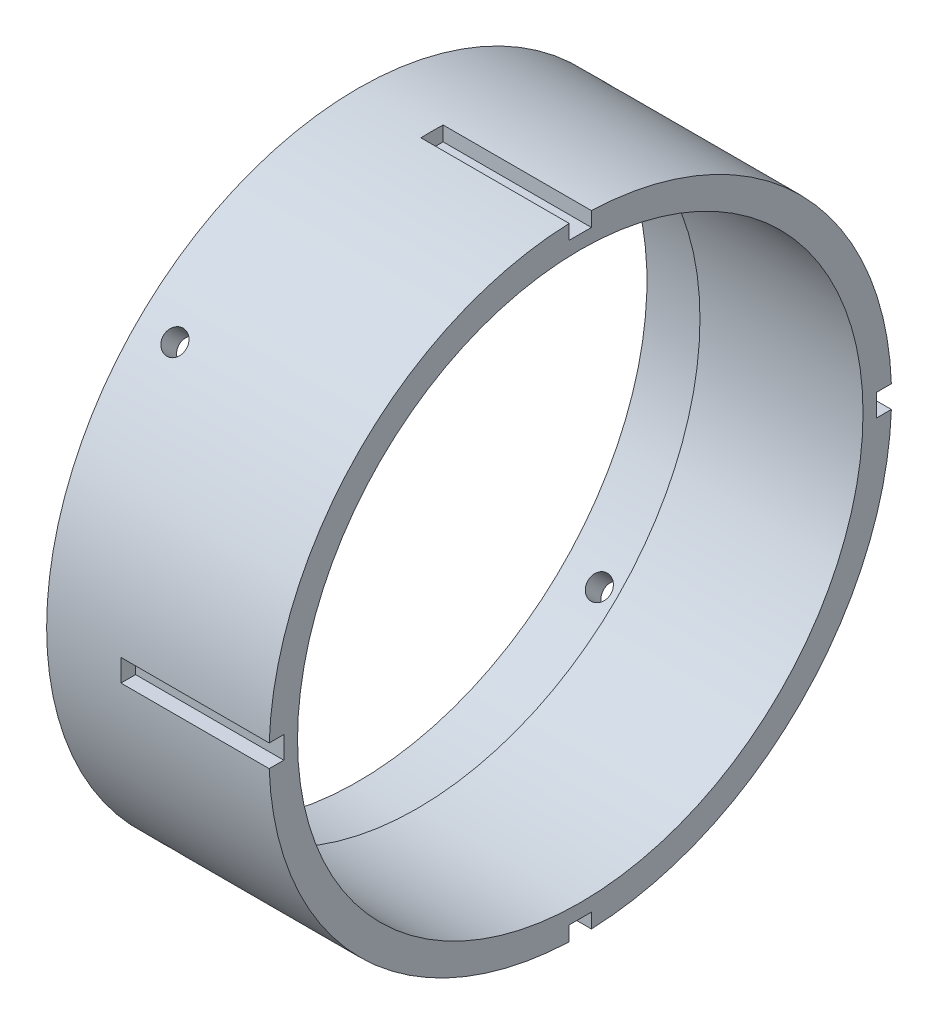
from build123d import *

# Parameters (mm, degrees)
ESQUISSE1_W                  = 30
ESQUISSE1_H                  = 3.85
D_GAGEMENT_M2_51_D           = 3.1
R_P_TITION_CIRCULAIRE1_COUNT = 2
R_P_TITION_CIRCULAIRE1_ANGLE = 90
ESQUISSE4_W                  = 3
ESQUISSE4_H                  = 15
ENL_V_MAT_EXTRU_1_DEPTH      = 20
R_P_TITION_START             = 10
R_P_TITION_CIRCULAIRE2_DEPTH = 20
ESQUISSE5_R                  = 39
ENL_V_MAT_EXTRU_2_DEPTH      = 8


# Read off the part's stored shape, not the designer's step: Répétition circulaire2
with BuildPart() as part:
    # Esquisse1 → Révolution1 (revolve)
    with BuildSketch(Plane.XY, mode=Mode.PRIVATE) as r_volution1_sk:
        with Locations((15, 40.075)):
            Rectangle(ESQUISSE1_W, ESQUISSE1_H)
    revolve(r_volution1_sk.sketch.rotate(Axis((0, 0, 0), (1, 0, 0)), 90), axis=Axis((0, 0, 0), (1, 0, 0)))

    # Dégagement M2.51 (through all)
    with Locations(Plane(origin=(5, -29.69848481, -29.69848481), x_dir=(0, -0.707106781187, 0.707106781187), z_dir=(0, -0.707106781187, -0.707106781187))):
        with Locations((0, 0)):
            d_gagement_m2_51 = Hole(D_GAGEMENT_M2_51_D / 2)

    # Répétition circulaire1: Dégagement M2.51 ×2 about axis
    r_p_tition_circulaire1_axis = Axis((0, 0, 0), (-1, 0, 0))
    for i in range(1, R_P_TITION_CIRCULAIRE1_COUNT):
        add(d_gagement_m2_51.rotate(r_p_tition_circulaire1_axis, i * R_P_TITION_CIRCULAIRE1_ANGLE / (R_P_TITION_CIRCULAIRE1_COUNT - 1)), mode=Mode.SUBTRACT)

    # Esquisse4 → Enlèv. mat.-Extru.1 (cut)
    with BuildSketch(Plane(origin=(30, 0, 0), x_dir=(0, 0, -1), z_dir=(1, 0, 0))):
        with Locations((0, -47.5)):
            Rectangle(ESQUISSE4_W, ESQUISSE4_H)
    extrude(amount=-ENL_V_MAT_EXTRU_1_DEPTH, mode=Mode.SUBTRACT)

    # Répétition circulaire2 outline → Répétition circulaire2 (cut)
    with BuildSketch(Plane.YZ.offset(R_P_TITION_START)):
        with BuildLine():
            ThreePointArc((41.973205739, -1.5), (42, 0), (41.973205739, 1.5))
            Line((41.973205739, 1.5), (40, 1.5))
            Line((40, 1.5), (40, -1.5))
            Line((40, -1.5), (41.973205739, -1.5))
        make_face()
        with BuildLine():
            Line((1.5, 40), (1.5, 41.973205739))
            ThreePointArc((1.5, 41.973205739), (0, 42), (-1.5, 41.973205739))
            Line((-1.5, 41.973205739), (-1.5, 40))
            Line((-1.5, 40), (1.5, 40))
        make_face()
        with BuildLine():
            ThreePointArc((-1.5, -41.973205739), (0, -42), (1.5, -41.973205739))
            Line((1.5, -41.973205739), (1.5, -40))
            Line((1.5, -40), (-1.5, -40))
            Line((-1.5, -40), (-1.5, -41.973205739))
        make_face()
    extrude(amount=R_P_TITION_CIRCULAIRE2_DEPTH, mode=Mode.SUBTRACT)

    # Esquisse5 → Enlèv. mat.-Extru.2 (cut)
    with BuildSketch(Plane.ZY):
        Circle(ESQUISSE5_R)
    extrude(amount=-ENL_V_MAT_EXTRU_2_DEPTH, mode=Mode.SUBTRACT)


solid = part.part
